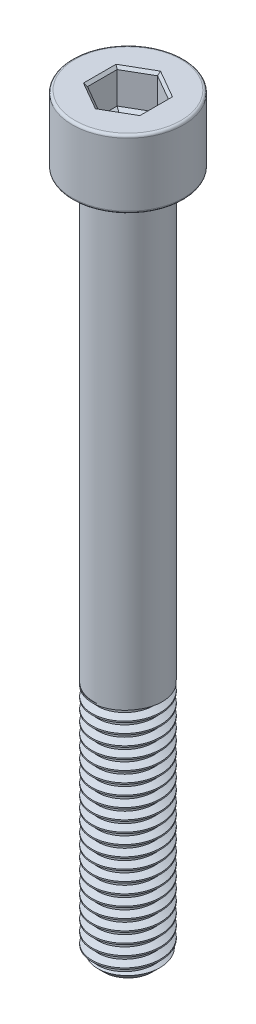
from build123d import *

# Parameters (mm, degrees)
SKETCH1_R           = 4
BOSS_EXTRUDE1_DEPTH = 28
THREAD1_PITCH       = 1.25
SKETCH2_R           = 4
BOSS_EXTRUDE2_DEPTH = 52
SKETCH5_R           = 6.5
BOSS_EXTRUDE3_DEPTH = 8
FILLET1_R           = 0.3
CUT_EXTRUDE1_DEPTH  = 4
CHAMFER1_SIZE       = 0.3
CUT_EXTRUDE2_DEPTH  = 0.4
CUT_EXTRUDE2_DRAFT  = -60


with BuildPart() as part:
    # Sketch1 → Boss-Extrude1 (new body)
    with BuildSketch(Plane(origin=(0, 0, 0), x_dir=(1, 0, 0), z_dir=(0, 1, 0))):
        with Locations(Location((0, 0, 0), (0, 0, 270))):
            Circle(SKETCH1_R)
    extrude(amount=BOSS_EXTRUDE1_DEPTH)

    # Thread1: the profile of Thread Profile1 profile screwed along a right-hand helix of 24 turns, 8 arcs to a turn; built about Z, then put on its axis
    thread1_z = Axis((0, 0, 0), (0, 0, 1))
    thread1_corners = [(4.0003, 0, -0.000173205), (4.0003, 0, 1.093923202), (3.323417656, 0, 0.703124998), (3.323417656, 0, 0.390624998)]
    with BuildLine(mode=Mode.PRIVATE) as thread1_profile:
        Line(thread1_corners[0], thread1_corners[1])
        Line(thread1_corners[1], thread1_corners[2])
        Line(thread1_corners[2], thread1_corners[3])
        Line(thread1_corners[3], thread1_corners[0])
    thread1_cap = Face(thread1_profile.wire())
    thread1_turn_angles = [0, 22.5, 45, 67.5, 90, 112.5, 135, 157.5, 180, 202.5, 225, 247.5, 270, 292.5, 315, 337.5, 360]
    thread1_turn_weights = [1, 0.9238795325112867, 1, 0.9238795325112867, 1, 0.9238795325112867, 1, 0.9238795325112867, 1, 0.9238795325112867, 1, 0.9238795325112867, 1, 0.9238795325112867, 1, 0.9238795325112867, 1]
    thread1_turn_rails = [Edge.make_bspline([Vector(p[0], p[1], 0).rotate(thread1_z, thread1_turn_angles[k]) / thread1_turn_weights[k] + Vector(0, 0, p[2] + THREAD1_PITCH * thread1_turn_angles[k] / 360) for k in range(17)], [0, 0, 0, 1, 1, 2, 2, 3, 3, 4, 4, 5, 5, 6, 6, 7, 7, 8, 8, 8], 2, thread1_turn_weights) for p in thread1_corners]
    thread1_turn_sides = [Face.make_surface_from_curves(thread1_turn_rails[p[0]], thread1_turn_rails[p[1]]) for p in [(0, 1), (1, 2), (2, 3), (3, 0)]]
    thread1 = Plane(origin=(0, 30, 0), x_dir=(-1, 0, 0), z_dir=(0, -1, 0)) * Solid(Shell([*[p.moved(Location((0, 0, THREAD1_PITCH * i))) for i in range(24) for p in thread1_turn_sides], thread1_cap, thread1_cap.rotate(thread1_z, 8640).moved(Location((0, 0, THREAD1_PITCH * 8640 / 360)))]))
    add(thread1, mode=Mode.SUBTRACT)

    # Sketch2 → Boss-Extrude2 (add)
    with BuildSketch(Plane(origin=(0, 28, 0), x_dir=(1, 0, 0), z_dir=(0, 1, 0))):
        with Locations(Location((0, 0, 0), (0, 0, 117.593571361))):
            Circle(SKETCH2_R)
    extrude(amount=BOSS_EXTRUDE2_DEPTH)

    # Sketch5 → Boss-Extrude3 (add)
    with BuildSketch(Plane(origin=(0, 80, 0), x_dir=(1, 0, 0), z_dir=(0, 1, 0))):
        with Locations(Location((0, 0, 0), (0, 0, 270))):
            Circle(SKETCH5_R)
    extrude(amount=BOSS_EXTRUDE3_DEPTH)

    # Sketch6 → Cut-Revolve1 (revolve, cut)
    with BuildSketch(Plane.XY, mode=Mode.PRIVATE) as cut_revolve1_sk:
        Polygon((4.01, 0), (4.01, 1.2), (2.81, 0), align=None)
    revolve(cut_revolve1_sk.sketch.rotate(Axis((0, 0, 0), (0, 1, 0)), 117.593571361), axis=Axis((0, 0, 0), (0, 1, 0)), mode=Mode.SUBTRACT)

    # Fillet1
    fillet1_edges = [part.edges().sort_by_distance(p)[0] for p in [
        (0, 80, -6.5),
        (0, 88, -6.5),
    ]]
    fillet(fillet1_edges, radius=FILLET1_R)

    # Sketch7 → Cut-Extrude1 (cut)
    with BuildSketch(Plane(origin=(0, 88, 0), x_dir=(1, 0, 0), z_dir=(0, 1, 0))):
        Polygon((0, 3.464101615), (-3, 1.732050808), (-3, -1.732050808), (0, -3.464101615), (3, -1.732050808), (3, 1.732050808), align=None)
    extrude(amount=-CUT_EXTRUDE1_DEPTH, mode=Mode.SUBTRACT)

    # Chamfer1
    chamfer1_edges = [part.edges().sort_by_distance(p)[0] for p in [
        (1.5, 88, -2.598076211),
        (-1.5, 88, -2.598076211),
        (-3, 88, 0),
        (-1.5, 88, 2.598076211),
        (1.5, 88, 2.598076211),
        (3, 88, 0),
    ]]
    chamfer(chamfer1_edges, length=CHAMFER1_SIZE)


with BuildPart() as cut_extrude2_tool:
    # Sketch8 → Cut-Extrude2 (with draft: the straight prism first)
    with BuildSketch(Plane(origin=(0, 84, 0), x_dir=(1, 0, 0), z_dir=(0, 1, 0))):
        Polygon((0, 3.464101615), (-3, 1.732050808), (-3, -1.732050808), (0, -3.464101615), (3, -1.732050808), (3, 1.732050808), align=None)
    extrude(amount=-CUT_EXTRUDE2_DEPTH)
    # Cut-Extrude2: the draft: its side faces are tilted about the plane it starts from
    cut_extrude2_sides = [cut_extrude2_tool.faces().sort_by_distance(p)[0] for p in [
        (-1.5, 83.8, -2.598076211),
        (-3, 83.8, 0),
        (-1.5, 83.8, 2.598076211),
        (1.5, 83.8, 2.598076211),
        (3, 83.8, 0),
        (1.5, 83.8, -2.598076211),
    ]]
    draft(cut_extrude2_sides, Plane(origin=(0, 84, 0), x_dir=(1, 0, 0), z_dir=(0, 1, 0)), CUT_EXTRUDE2_DRAFT)


with BuildPart() as part_1:
    add(part.part)

    # Cut-Extrude2: cut by cut_extrude2_tool
    add(cut_extrude2_tool.part, mode=Mode.SUBTRACT)


solid = part_1.part
